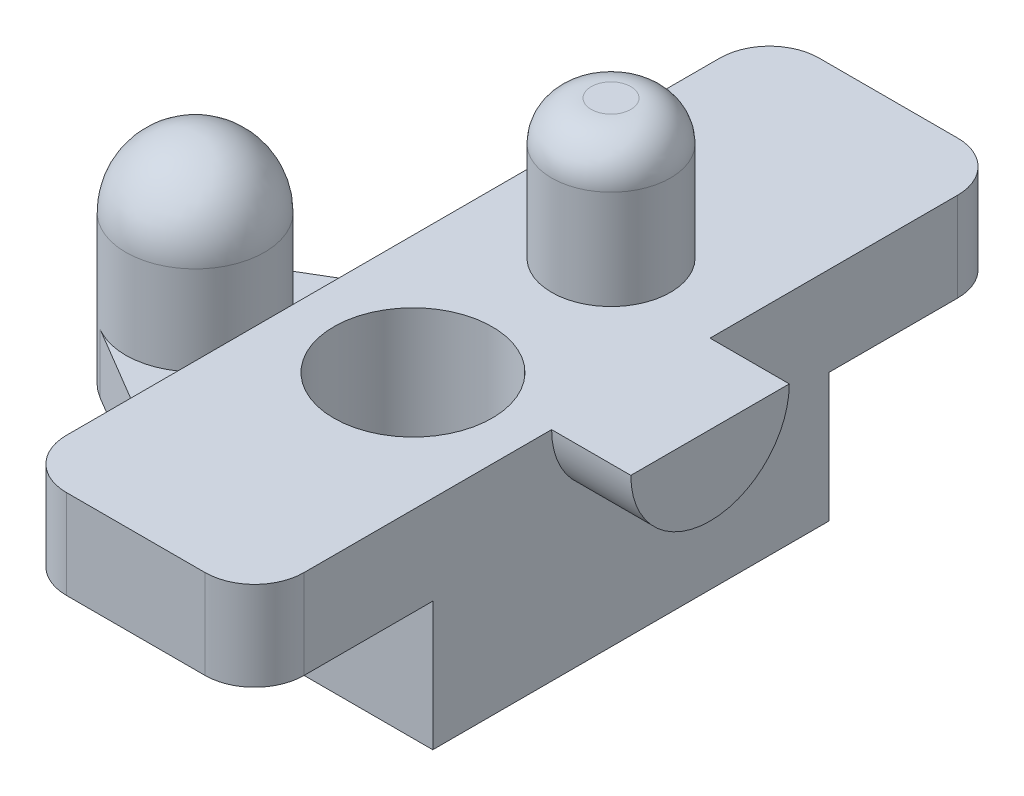
from build123d import *
from build123d.topology import SkipClean

# Parameters (mm, degrees)
BOSS_EXTRUDE1_DEPTH = 1.5
BOSS_EXTRUDE2_START = 4
SKETCH2_R           = 1.75
SKETCH2_W           = 6
SKETCH2_H           = 10
BOSS_EXTRUDE2_DEPTH = 4
BOSS_EXTRUDE3_DEPTH = 2.25
FILLET1_R           = 1.75
SKETCH4_R           = 1.5
BOSS_EXTRUDE4_DEPTH = 3.5
FILLET2_R           = 1
SKETCH5_R           = 2
CUT_EXTRUDE1_DEPTH  = 3.75
BOSS_EXTRUDE5_DEPTH = 2


with BuildPart() as part:
    # Sketch1 → Boss-Extrude1 (new body)
    with BuildSketch(Plane(origin=(0, 0, 0), x_dir=(1, 0, 0), z_dir=(0, 1, 0))):
        with BuildLine():
            Line((5, 5), (11, 5))
            Line((11, 5), (11, -5))
            Line((11, -5), (5, -5))
            Line((5, -5), (-0.892692, -1.505192))
            ThreePointArc((-0.892692, -1.505192), (-1.75, 0), (-0.892692, 1.505192))
            Line((-0.892692, 1.505192), (5, 5))
        make_face()
    extrude(amount=-BOSS_EXTRUDE1_DEPTH)

    # Sketch2 → Boss-Extrude2 (add)
    with SkipClean():  # the faces are left unmerged after this step: merging them gives an invalid solid
        with BuildSketch(Plane(origin=(0, 0, 0), x_dir=(1, 0, 0), z_dir=(0, 1, 0)).offset(BOSS_EXTRUDE2_START)):
            Circle(SKETCH2_R)
            with Locations((8, 0)):
                Rectangle(SKETCH2_W, SKETCH2_H)
        extrude(amount=-BOSS_EXTRUDE2_DEPTH)

    # Sketch3 → Boss-Extrude3 (add)
    with SkipClean():  # the faces are left unmerged after this step: merging them gives an invalid solid
        with BuildSketch(Plane(origin=(0, 4, 0), x_dir=(1, 0, 0), z_dir=(0, 1, 0))):
            with BuildLine():
                Line((5, 5), (11, 5))
                Line((11, 5), (11, 8.25))
                ThreePointArc((11, 8.25), (10.633883, 9.133883), (9.75, 9.5))
                Line((9.75, 9.5), (6.25, 9.5))
                ThreePointArc((6.25, 9.5), (5.366117, 9.133883), (5, 8.25))
                Line((5, 8.25), (5, 5))
            make_face()
            with BuildLine():
                Line((5, -5), (11, -5))
                Line((11, -5), (11, -8.25))
                ThreePointArc((11, -8.25), (10.633883, -9.133883), (9.75, -9.5))
                Line((9.75, -9.5), (6.25, -9.5))
                ThreePointArc((6.25, -9.5), (5.366117, -9.133883), (5, -8.25))
                Line((5, -8.25), (5, -5))
            make_face()
        extrude(amount=-BOSS_EXTRUDE3_DEPTH)

    # Fillet1
    fillet1_edges = [part.edges().sort_by_distance(p)[0] for p in [
        (-1.75, 4, 0),
    ]]
    fillet(fillet1_edges, radius=FILLET1_R)

    # Sketch4 → Boss-Extrude4 (add)
    with SkipClean():  # the faces are left unmerged after this step: merging them gives an invalid solid
        with BuildSketch(Plane(origin=(0, 4, 0), x_dir=(1, 0, 0), z_dir=(0, 1, 0))):
            with Locations((8, 2.5)):
                Circle(SKETCH4_R)
        extrude(amount=BOSS_EXTRUDE4_DEPTH)

    # Fillet2
    fillet2_edges = [part.edges().sort_by_distance(p)[0] for p in [
        (6.5, 7.5, -2.5),
    ]]
    fillet(fillet2_edges, radius=FILLET2_R)

    # Sketch5 → Cut-Extrude1 (cut)
    with SkipClean():  # the faces are left unmerged after this step: merging them gives an invalid solid
        with BuildSketch(Plane(origin=(0, 4, 0), x_dir=(1, 0, 0), z_dir=(0, 1, 0))):
            with Locations((8, -2.5)):
                Circle(SKETCH5_R)
        extrude(amount=-CUT_EXTRUDE1_DEPTH, mode=Mode.SUBTRACT)

    # Sketch6 → Boss-Extrude5 (add)
    with SkipClean():  # the faces are left unmerged after this step: merging them gives an invalid solid
        with BuildSketch(Plane(origin=(11, 0, 0), x_dir=(0, 0, -1), z_dir=(1, 0, 0))):
            with BuildLine():
                Line((-2, 4), (2, 4))
                ThreePointArc((2, 4), (0, 2), (-2, 4))
            make_face()
        extrude(amount=BOSS_EXTRUDE5_DEPTH)


solid = part.part
